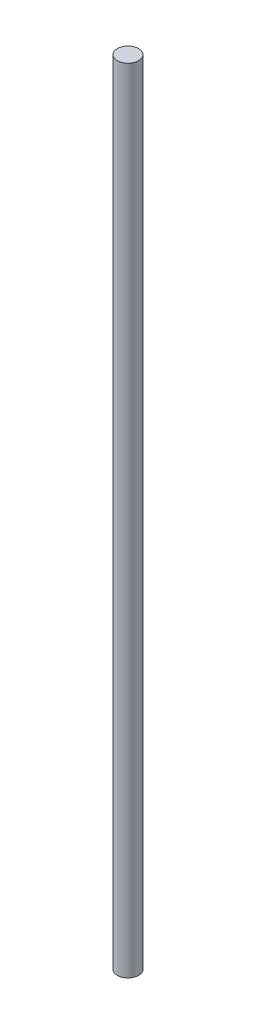
from build123d import *

# Parameters (mm, degrees)
SKETCH1_R           = 3.175
BOSS_EXTRUDE1_DEPTH = 237.300000126


with BuildPart() as part:
    # Sketch1 → Boss-Extrude1 (new body)
    with BuildSketch(Plane(origin=(0, 0, 0), x_dir=(1, 0, 0), z_dir=(0, 1, 0))):
        Circle(SKETCH1_R)
    extrude(amount=BOSS_EXTRUDE1_DEPTH)


solid = part.part
